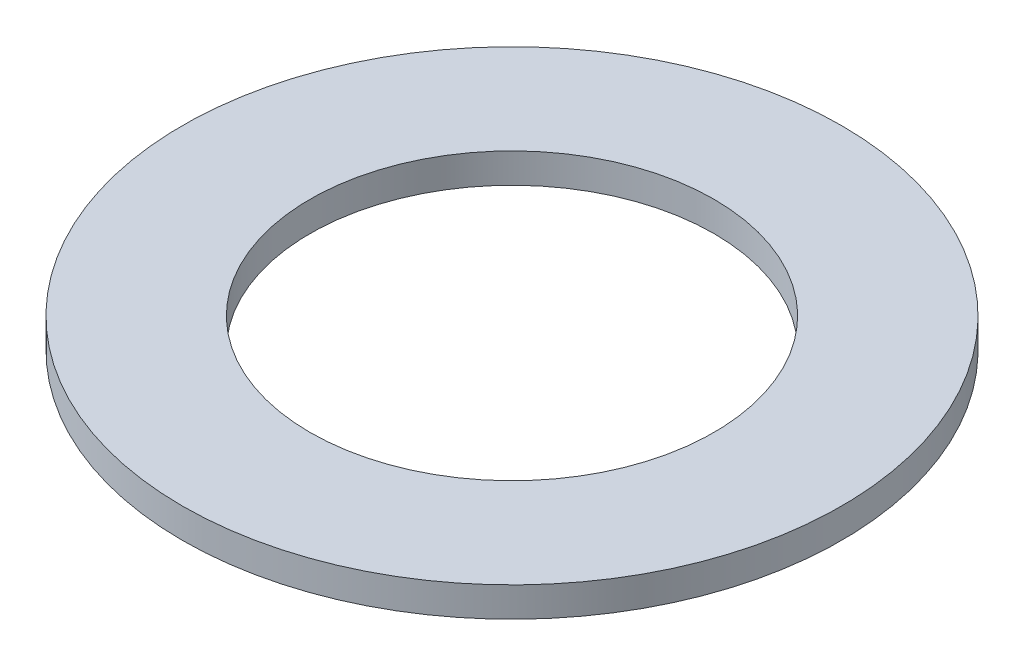
from build123d import *

# Parameters (mm, degrees)
SKETCH1_R           = 77.5
BOSS_EXTRUDE1_DEPTH = 7
SKETCH2_R           = 47.5
CUT_EXTRUDE1_DEPTH  = 110.824860574


with BuildPart() as part:
    # Sketch1 → Boss-Extrude1 (new body)
    with BuildSketch(Plane(origin=(0, 0, 0), x_dir=(1, 0, 0), z_dir=(0, 1, 0))):
        Circle(SKETCH1_R)
    extrude(amount=BOSS_EXTRUDE1_DEPTH)

    # Sketch2 → Cut-Extrude1 (cut, through all)
    with BuildSketch(Plane(origin=(0, 0, 0), x_dir=(1, 0, 0), z_dir=(0, 1, 0))):
        Circle(SKETCH2_R)
    extrude(amount=CUT_EXTRUDE1_DEPTH, mode=Mode.SUBTRACT)


solid = part.part
